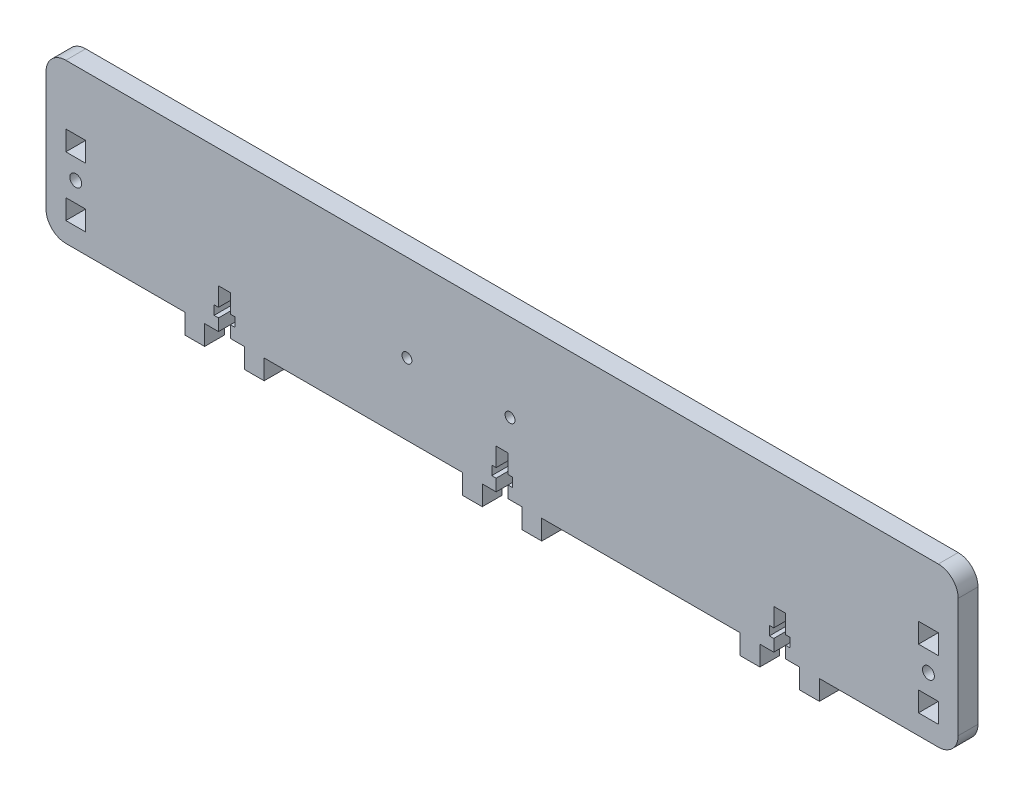
from build123d import *

# Parameters (mm, degrees)
BOSS_EXTRU_1_OUTLINE_W   = 5
BOSS_EXTRU_1_OUTLINE_H   = 5
BOSS_EXTRU_1_OUTLINE_R   = 1.5
BOSS_EXTRU_1_OUTLINE_R_2 = 1.25
BOSS_EXTRU_1_DEPTH       = 5
CONG_1_R                 = 5


# Read off the part's stored shape, not the designer's step: Boss.-Extru.1
with BuildPart() as part:
    # Boss.-Extru.1 outline → Boss.-Extru.1 (new body)
    with BuildSketch(Plane.XY):
        Polygon((47.6, 5.3), (47.6, 3), (46.5, 3), (46.5, 0), (50, 0), (50, -5), (55, -5), (55, 0), (105, 0), (105, -5), (110, -5), (110, 0), (113.5, 0), (113.5, 3), (112.4, 3), (112.4, 5.3), (113.5, 5.3), (113.5, 10), (116.5, 10), (116.5, 5.3), (117.6, 5.3), (117.6, 3), (116.5, 3), (116.5, 0), (120, 0), (120, -5), (125, -5), (125, 0), (175, 0), (175, -5), (180, -5), (180, 0), (183.5, 0), (183.5, 3), (182.4, 3), (182.4, 5.3), (183.5, 5.3), (183.5, 10), (186.5, 10), (186.5, 5.3), (187.6, 5.3), (187.6, 3), (186.5, 3), (186.5, 0), (190, 0), (190, -5), (195, -5), (195, 0), (230, 0), (230, 40), (0, 40), (0, 0), (35, 0), (35, -5), (40, -5), (40, 0), (43.5, 0), (43.5, 3), (42.4, 3), (42.4, 5.3), (43.5, 5.3), (43.5, 10), (46.5, 10), (46.5, 5.3), align=None)
        with Locations((7.5, 7.5)):
            Rectangle(BOSS_EXTRU_1_OUTLINE_W, BOSS_EXTRU_1_OUTLINE_H, mode=Mode.SUBTRACT)
        with Locations((7.5, 15)):
            Circle(BOSS_EXTRU_1_OUTLINE_R, mode=Mode.SUBTRACT)
        with Locations((222.5, 7.5)):
            Rectangle(BOSS_EXTRU_1_OUTLINE_W, BOSS_EXTRU_1_OUTLINE_H, mode=Mode.SUBTRACT)
        with Locations((222.5, 15)):
            Circle(BOSS_EXTRU_1_OUTLINE_R, mode=Mode.SUBTRACT)
        with Locations((7.5, 22.5)):
            Rectangle(BOSS_EXTRU_1_OUTLINE_W, BOSS_EXTRU_1_OUTLINE_H, mode=Mode.SUBTRACT)
        with Locations((91, 18)):
            Circle(BOSS_EXTRU_1_OUTLINE_R_2, mode=Mode.SUBTRACT)
        with Locations((117, 18)):
            Circle(BOSS_EXTRU_1_OUTLINE_R_2, mode=Mode.SUBTRACT)
        with Locations((222.5, 22.5)):
            Rectangle(BOSS_EXTRU_1_OUTLINE_W, BOSS_EXTRU_1_OUTLINE_H, mode=Mode.SUBTRACT)
    extrude(amount=BOSS_EXTRU_1_DEPTH)

    # Congé1
    cong_1_edges = [part.edges().sort_by_distance(p)[0] for p in [
        (0, 0, 2.5),
        (0, 40, 2.5),
        (230, 40, 2.5),
        (230, 0, 2.5),
    ]]
    fillet(cong_1_edges, radius=CONG_1_R)


solid = part.part
